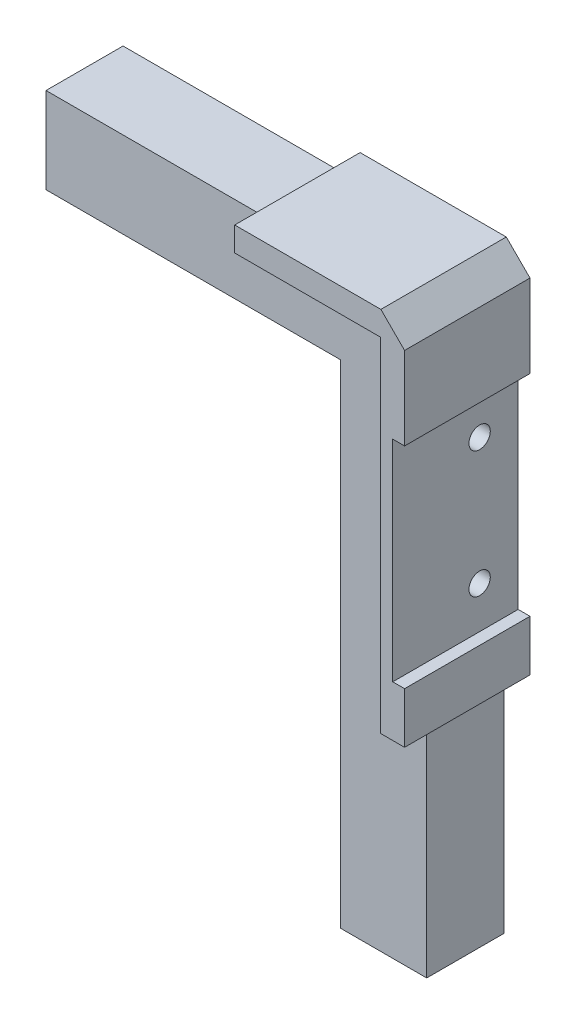
from build123d import *

# Parameters (mm, degrees)
BODY_AND_TONGUES_DEPTH = 4.875
RIM_DEPTH              = 7.935
BRACKET_SEAT_SKETCH_W  = 2.5
BRACKET_SEAT_SKETCH_H  = 26.6
BRACKET_SEAT_DEPTH     = 8.935
SCREW_PILOTS_SKETCH_R  = 1.35
SCREW_PILOTS_DEPTH     = 5.5


with BuildPart() as part:
    # body and tongues sketch → body and tongues (new, symmetric)
    with BuildSketch(Plane.XY.offset(20.375)):
        Polygon((3.42, 3.07), (0.42, 6.07), (-18.08, 6.07), (-18.08, 2.75), (-48.08, 2.75), (-48.08, -8.13), (-10.78, -8.13), (-10.78, -70.43), (0.1, -70.43), (0.1, -40.43), (3.42, -40.43), align=None)
    extrude(amount=BODY_AND_TONGUES_DEPTH, both=True)

    # rim sketch → rim (add, symmetric)
    with BuildSketch(Plane.XY.offset(23.435)):
        Polygon((3.42, 3.07), (0.42, 6.07), (-18.08, 6.07), (-18.08, 3), (0.35, 3), (0.35, -40.43), (3.42, -40.43), align=None)
    extrude(amount=RIM_DEPTH, both=True)

    # bracket seat sketch → bracket seat (cut, symmetric)
    with BuildSketch(Plane.XY.offset(23.435)):
        with Locations((3.17, -20.7)):
            Rectangle(BRACKET_SEAT_SKETCH_W, BRACKET_SEAT_SKETCH_H)
    extrude(amount=BRACKET_SEAT_DEPTH, both=True, mode=Mode.SUBTRACT)

    # screw pilots sketch → screw pilots (cut, symmetric)
    with BuildSketch(Plane(origin=(-2.58, 0, 0), x_dir=(0, 0, -1), z_dir=(1, 0, 0))):
        with Locations((-20.375, -28.7)):
            Circle(SCREW_PILOTS_SKETCH_R)
        with Locations((-20.375, -12.7)):
            Circle(SCREW_PILOTS_SKETCH_R)
    extrude(amount=SCREW_PILOTS_DEPTH, both=True, mode=Mode.SUBTRACT)


solid = part.part
